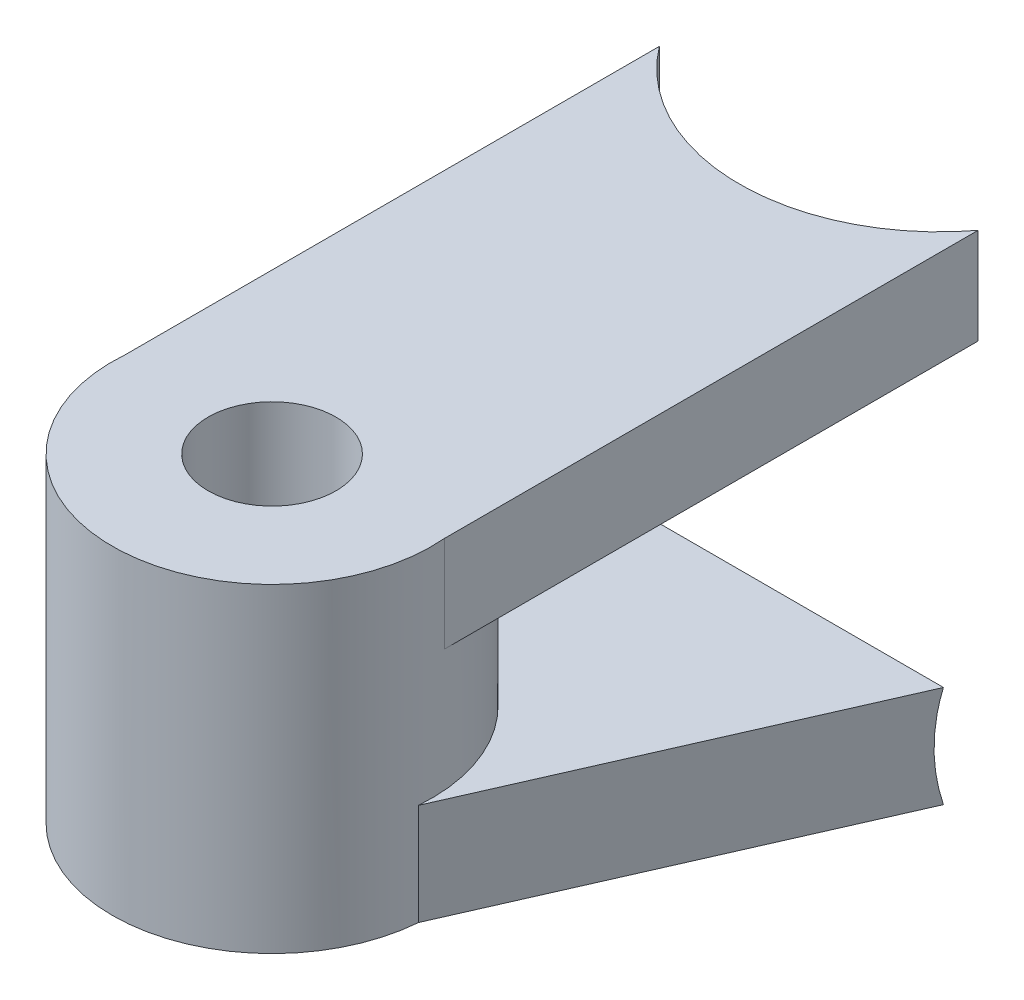
from build123d import *

# Parameters (mm, degrees)
BOSS_EXTRUDE1_DEPTH = 6.35
SKETCH1_3_R         = 4
BOSS_EXTRUDE2_DEPTH = 20
SKETCH2_R           = 12.5
CUT_EXTRUDE1_DEPTH  = 55.990908339
BOSS_EXTRUDE3_START = -6
BOSS_EXTRUDE3_DEPTH = 6


with BuildPart() as part:
    # Sketch1 → Boss-Extrude1 (new body)
    with BuildSketch(Plane(origin=(0, 0, 0), x_dir=(1, 0, 0), z_dir=(0, 1, 0))):
        with BuildLine():
            Line((40, 0), (0, 0))
            Line((0, 0), (10.032558322, -22.806291758))
            ThreePointArc((10.032558322, -22.806291758), (19.596525576, -12.008142896), (30, -22))
            ThreePointArc((30, -22), (29.991857104, -22.403474424), (29.967441678, -22.806291758))
            Line((29.967441678, -22.806291758), (40, 0))
        make_face()
    extrude(amount=BOSS_EXTRUDE1_DEPTH)

    # Sketch1<3> → Boss-Extrude2 (add)
    with BuildSketch(Plane(origin=(0, 0, 0), x_dir=(1, 0, 0), z_dir=(0, 1, 0))):
        with BuildLine():
            ThreePointArc((30, -22), (19.596525576, -12.008142896), (10.032558322, -22.806291758))
            ThreePointArc((10.032558322, -22.806291758), (20, -32), (29.967441678, -22.806291758))
            ThreePointArc((29.967441678, -22.806291758), (29.991857104, -22.403474424), (30, -22))
        make_face()
        with Locations((20, -22)):
            Circle(SKETCH1_3_R, mode=Mode.SUBTRACT)
    extrude(amount=BOSS_EXTRUDE2_DEPTH)

    # Sketch2 → Cut-Extrude1 (cut, through all)
    with BuildSketch(Plane(origin=(0, 0, 0), x_dir=(0, 0, -1), z_dir=(1, 0, 0))):
        with Locations((12.090052729, 3.175)):
            Circle(SKETCH2_R)
    extrude(amount=CUT_EXTRUDE1_DEPTH, mode=Mode.SUBTRACT)

    # Sketch3 → Boss-Extrude3 (add)
    with BuildSketch(Plane(origin=(0, 20, 0), x_dir=(1, 0, 0), z_dir=(0, 1, 0)).offset(BOSS_EXTRUDE3_START)):
        with BuildLine():
            Line((10.032558322, 12.193708242), (10.032558322, -21.193708242))
            ThreePointArc((10.032558322, -21.193708242), (20, -12), (29.967441678, -21.193708242))
            Line((29.967441678, -21.193708242), (29.967441678, 12.193708242))
            ThreePointArc((29.967441678, 12.193708242), (20, 7.236924161), (10.032558322, 12.193708242))
        make_face()
    extrude(amount=BOSS_EXTRUDE3_DEPTH)


solid = part.part
